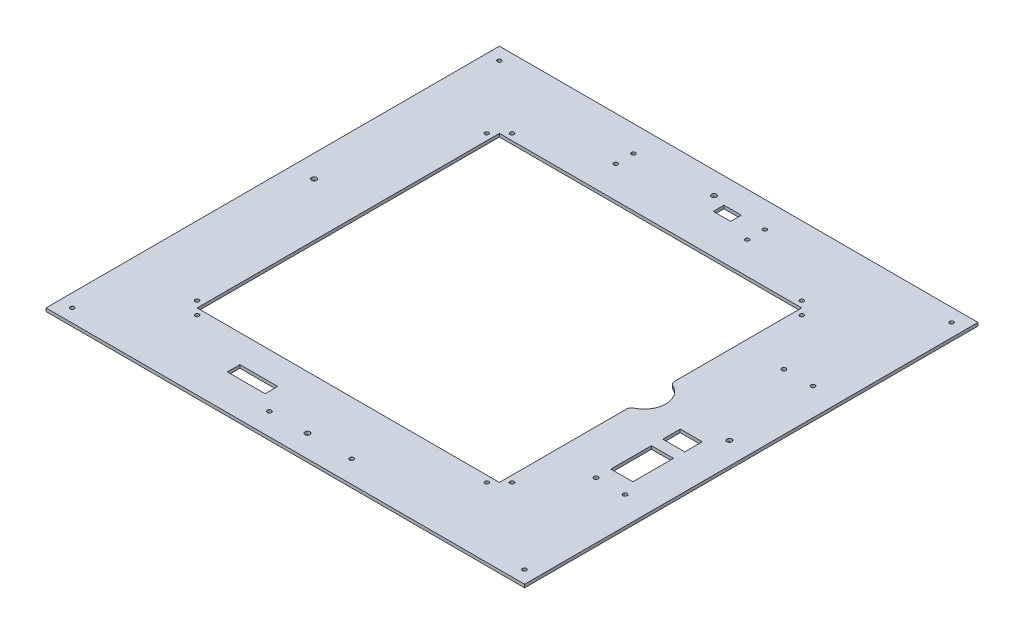
from build123d import *

# Parameters (mm, degrees)
SKETCH1_W           = 482.6
SKETCH1_H           = 457.2
SKETCH1_R           = 2
SKETCH1_W_2         = 38.1
SKETCH1_H_2         = 12.7
SKETCH1_R_2         = 2.1
SKETCH1_R_3         = 2.54
SKETCH1_R_4         = 2.159
SKETCH1_R_5         = 2.0955
SKETCH1_W_3         = 22.197164078
SKETCH1_H_3         = 40.943496447
SKETCH1_H_4         = 17.6350312
SKETCH1_W_4         = 17.438820998
SKETCH1_H_5         = 10.883645004
BOSS_EXTRUDE1_DEPTH = 3.175
FILLET2_R           = 5


with BuildPart() as part:
    # Sketch1 → Boss-Extrude1 (new body)
    with BuildSketch(Plane(origin=(0, 0, 0), x_dir=(1, 0, 0), z_dir=(0, 1, 0))):
        with Locations((-1.251503591, 0)):
            Rectangle(SKETCH1_W, SKETCH1_H)
        with Locations((-229.375503591, -215.2716)):
            Circle(SKETCH1_R, mode=Mode.SUBTRACT)
        with Locations((-160.033503591, -158.782)):
            Circle(SKETCH1_R, mode=Mode.SUBTRACT)
        with Locations((-172.733503591, -146.082)):
            Circle(SKETCH1_R, mode=Mode.SUBTRACT)
        with Locations((-76.181503591, -186.695610311)):
            Rectangle(SKETCH1_W_2, SKETCH1_H_2, mode=Mode.SUBTRACT)
        with Locations((-39.643603591, -206.2861)):
            Circle(SKETCH1_R_2, mode=Mode.SUBTRACT)
        with Locations((-1.291503591, -206.2372)):
            Circle(SKETCH1_R_3, mode=Mode.SUBTRACT)
        with BuildLine():
            Line((-166.351503591, -152.4), (-166.351503591, 152.4))
            Line((-166.351503591, 152.4), (138.448496409, 152.4))
            Line((138.448496409, 152.4), (138.448496409, 20.741284059))
            ThreePointArc((138.448496409, 20.741284059), (153.790046939, 0), (138.448496409, -20.741284059))
            Line((138.448496409, -20.741284059), (138.448496409, -152.4))
            Line((138.448496409, -152.4), (-140.951503591, -152.4))
            Line((-140.951503591, -152.4), (-166.351503591, -152.4))
        make_face(mode=Mode.SUBTRACT)
        with Locations((43.338196409, -206.2861)):
            Circle(SKETCH1_R_2, mode=Mode.SUBTRACT)
        with Locations((227.228096409, -215.9066)):
            Circle(SKETCH1_R, mode=Mode.SUBTRACT)
        with Locations((132.130496409, -158.782)):
            Circle(SKETCH1_R, mode=Mode.SUBTRACT)
        with Locations((144.830496409, -146.082)):
            Circle(SKETCH1_R, mode=Mode.SUBTRACT)
        with Locations((182.985353882, -99.579800078)):
            Circle(SKETCH1_R_4, mode=Mode.SUBTRACT)
        with Locations((212.390436409, -99.579800078)):
            Circle(SKETCH1_R_5, mode=Mode.SUBTRACT)
        with Locations((194.083935921, -64.08358634)):
            Rectangle(SKETCH1_W_3, SKETCH1_H_3, mode=Mode.SUBTRACT)
        with Locations((194.083935921, -23.429524632)):
            Rectangle(SKETCH1_W_3, SKETCH1_H_4, mode=Mode.SUBTRACT)
        with Locations((-220.087103591, 19.264)):
            Circle(SKETCH1_R_3, mode=Mode.SUBTRACT)
        with Locations((-172.733503591, 146.082)):
            Circle(SKETCH1_R, mode=Mode.SUBTRACT)
        with Locations((-160.033503591, 158.782)):
            Circle(SKETCH1_R, mode=Mode.SUBTRACT)
        with Locations((-229.832703591, 215.8812)):
            Circle(SKETCH1_R, mode=Mode.SUBTRACT)
        with Locations((-81.109103591, 184.531)):
            Circle(SKETCH1_R, mode=Mode.SUBTRACT)
        with Locations((-81.109103591, 202.311)):
            Circle(SKETCH1_R, mode=Mode.SUBTRACT)
        with Locations((-3.831503591, 206.2626)):
            Circle(SKETCH1_R_3, mode=Mode.SUBTRACT)
        with Locations((217.711096409, 0.294)):
            Circle(SKETCH1_R_3, mode=Mode.SUBTRACT)
        with Locations((182.985353882, 89.827999922)):
            Circle(SKETCH1_R_4, mode=Mode.SUBTRACT)
        with Locations((212.390436409, 89.827999922)):
            Circle(SKETCH1_R_5, mode=Mode.SUBTRACT)
        with Locations((18.318465636, 197.512214728)):
            Rectangle(SKETCH1_W_4, SKETCH1_H_5, mode=Mode.SUBTRACT)
        with Locations((51.351896409, 184.531)):
            Circle(SKETCH1_R, mode=Mode.SUBTRACT)
        with Locations((51.351896409, 202.311)):
            Circle(SKETCH1_R, mode=Mode.SUBTRACT)
        with Locations((144.830496409, 146.082)):
            Circle(SKETCH1_R, mode=Mode.SUBTRACT)
        with Locations((132.130496409, 158.782)):
            Circle(SKETCH1_R, mode=Mode.SUBTRACT)
        with Locations((226.720096409, 215.2716)):
            Circle(SKETCH1_R, mode=Mode.SUBTRACT)
    extrude(amount=BOSS_EXTRUDE1_DEPTH)

    # Fillet2
    fillet2_edges = [part.edges().sort_by_distance(p)[0] for p in [
        (138.448496409, 1.5875, 20.741284059),
        (138.448496409, 1.5875, -20.741284059),
    ]]
    fillet(fillet2_edges, radius=FILLET2_R)


solid = part.part
